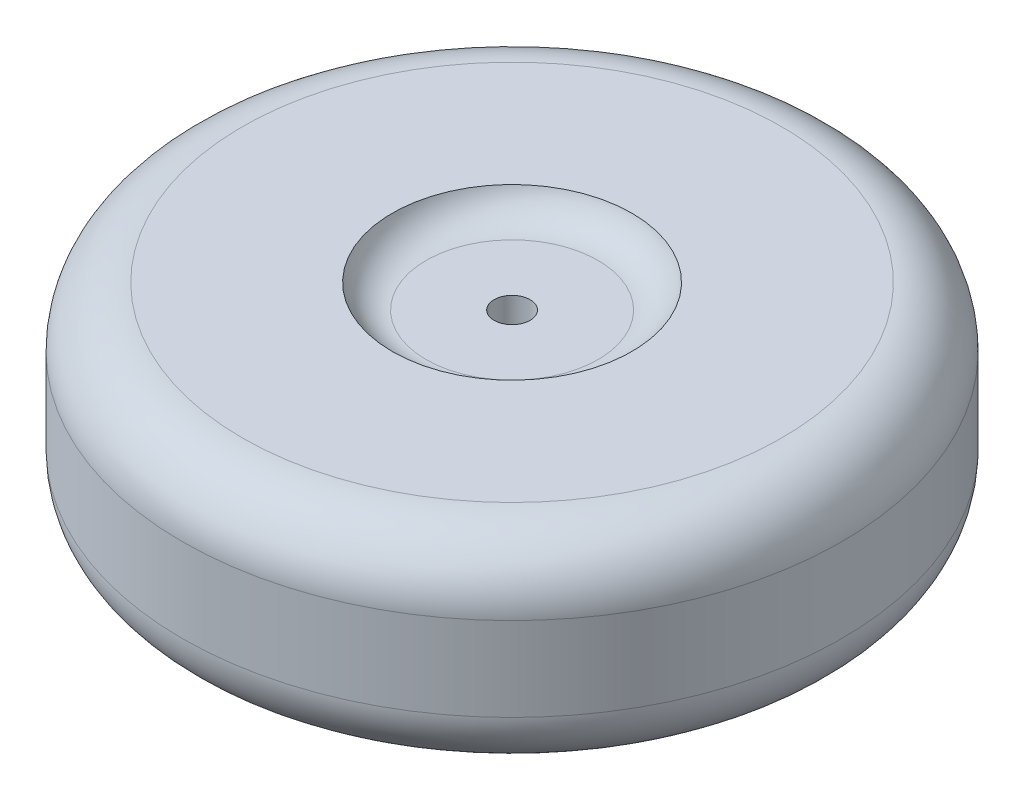
from build123d import *

# Parameters (mm, degrees)
SKETCH_1_R          = 27.5
EXTRUDE_1_DEPTH     = 17
FILLET_1_R          = 5
SKETCH_2_R          = 1.5
CUT_EXTRUDE_1_DEPTH = 43.444080989
SKETCH_3_R          = 10
CUT_EXTRUDE_2_DEPTH = 2
CUT_EXTRUDE_START   = -2
SKETCH_4_R          = 10
CUT_EXTRUDE_3_DEPTH = 2
FILLET_2_R          = 3


with BuildPart() as part:
    # 草图1 → 凸台-拉伸1 (new body)
    with BuildSketch(Plane(origin=(0, 0, 0), x_dir=(1, 0, 0), z_dir=(0, 1, 0))):
        with Locations(Location((0, 0, 0), (0, 0, 270))):
            Circle(SKETCH_1_R)
    extrude(amount=EXTRUDE_1_DEPTH)

    # 圆角1
    fillet_1_edges = [part.edges().sort_by_distance(p)[0] for p in [
        (0, 0, -27.5),
        (0, 17, -27.5),
    ]]
    fillet(fillet_1_edges, radius=FILLET_1_R)

    # 草图2 → 切除-拉伸1 (cut, through all)
    with BuildSketch(Plane.XZ):
        with Locations(Location((0, 0, 0), (0, 0, 270))):
            Circle(SKETCH_2_R)
    extrude(amount=-CUT_EXTRUDE_1_DEPTH, mode=Mode.SUBTRACT)

    # 草图3 → 切除-拉伸2 (cut)
    with BuildSketch(Plane(origin=(0, 17, 0), x_dir=(1, 0, 0), z_dir=(0, 1, 0))):
        with Locations(Location((0, 0, 0), (0, 0, 270))):
            Circle(SKETCH_3_R)
    extrude(amount=-CUT_EXTRUDE_2_DEPTH, mode=Mode.SUBTRACT)

    # 草图4 → 切除-拉伸3 (cut)
    with BuildSketch(Plane.XZ.offset(CUT_EXTRUDE_START)):
        with Locations(Location((0, 0, 0), (0, 0, 90))):
            Circle(SKETCH_4_R)
    extrude(amount=CUT_EXTRUDE_3_DEPTH, mode=Mode.SUBTRACT)

    # 圆角2
    # the kernel refuses this fillet: 3 mm, written as the material it adds along each edge
    with BuildSketch(Plane(origin=(0, 15, 0), x_dir=(0, 0, 1), z_dir=(-1, 0, 0))) as fillet_2_piece_1:
        with BuildLine():
            CenterArc((7.171572875, 3), FILLET_2_R, 270, 70.528779366)
            Line((7.171572875, 0), (7.171572875, -0.06))
            Line((7.171572875, -0.06), (10, -0.06))
            Line((10, -0.06), (10.06, 0))
            ThreePointArc((10.06, 0), (10.06, 1), (10.056568542, 1.98))
            Line((10.056568542, 1.98), (10, 2))
        make_face()
    revolve(axis=Axis((0, 15, 0), (0, 1, 0)))
    with BuildSketch(Plane(origin=(0, 2, 0), x_dir=(0, 0, 1), z_dir=(1, 0, 0))) as fillet_2_piece_2:
        with BuildLine():
            CenterArc((7.171572875, 3), FILLET_2_R, 270, 70.528779366)
            Line((7.171572875, 0), (7.171572875, -0.06))
            Line((7.171572875, -0.06), (10, -0.06))
            Line((10, -0.06), (10.06, 0))
            ThreePointArc((10.06, 0), (10.06, 1), (10.056568542, 1.98))
            Line((10.056568542, 1.98), (10, 2))
        make_face()
    revolve(axis=Axis((0, 2, 0), (0, -1, 0)))


solid = part.part
